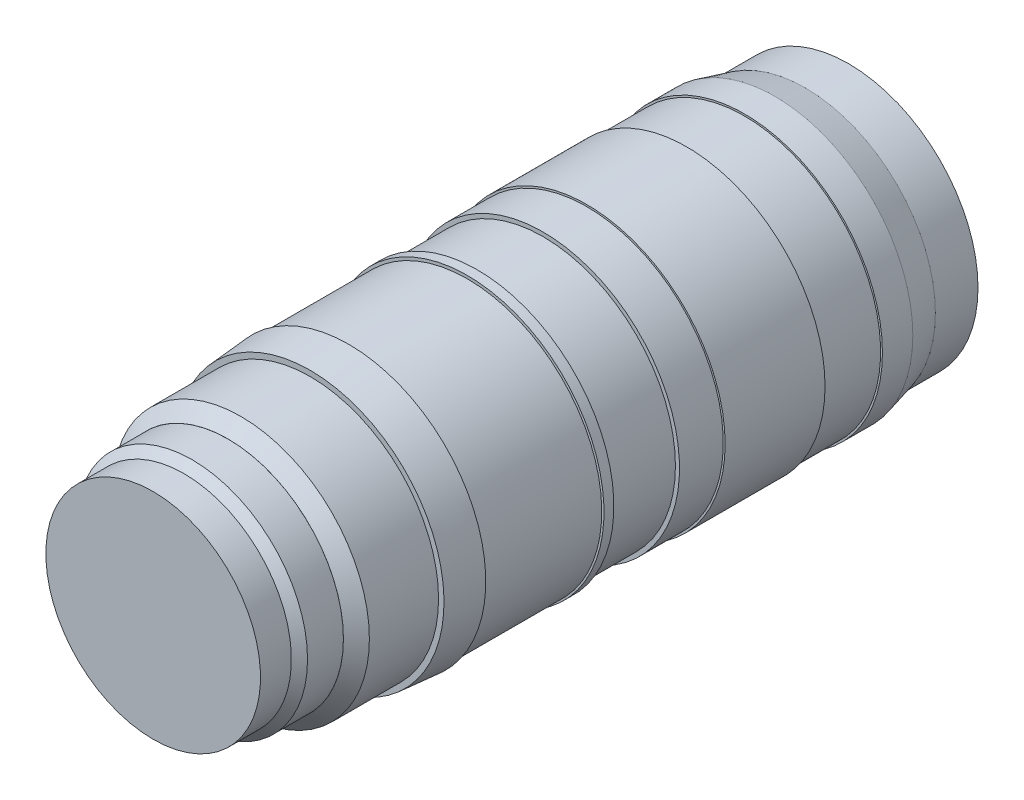
from build123d import *

# Parameters (mm, degrees)
CHAMFER1_SIZE       = 3.937
CHAMFER2_SIZE       = 2.54
SKETCH3_R           = 39.292876354
BOSS_EXTRUDE1_DEPTH = 13.15
SKETCH4_R           = 37.648699114
CUT_EXTRUDE1_DEPTH  = 2


with BuildPart() as part:
    # Sketch1 → Revolve1 (revolve)
    with BuildSketch(Plane(origin=(0, 0, 0), x_dir=(0, 0, -1), z_dir=(1, 0, 0))):
        Polygon((-107.78, -0.223974787), (-203.2, -0.223974787), (-203.2, 32.371025213), (-193.9, 32.371025213), (-193.9, 34.821025213), (-180.47, 34.821025213), (-180.47, 38.776025213), (-155.52, 38.776025213), (-155.52, 40.426025213), (-143.78, 41.376025213), (-143.78, 40.601025213), (-107.78, 40.601025213), align=None)
    revolve(axis=Axis((0, -0.223974787, 107.78), (0, 0, 1)))

    # Chamfer1
    chamfer1_edges = [part.edges().sort_by_distance(p)[0] for p in [
        (0, -39.223974787, 180.47),
    ]]
    chamfer(chamfer1_edges, length=CHAMFER1_SIZE)

    # Chamfer2
    # the kernel refuses this chamfer: 2.54 mm, written as the material it takes off along each edge
    with BuildSketch(Plane(origin=(0, -0.223974787, 193.9), x_dir=(0, 1, 0), z_dir=(1, 0, 0))) as chamfer2_piece_1_section:
        Polygon((35.045, -CHAMFER2_SIZE), (35.045 - CHAMFER2_SIZE, 0), (35.045, 0), align=None)
    chamfer2_piece_1 = revolve(axis=Axis((0, -0.223974787, 193.9), (0, 0, 1)), mode=Mode.PRIVATE)
    chamfer2_piece_1 = chamfer2_piece_1 - Plane(origin=(0, -0.223974787, 192.613574864), x_dir=(0, 1, 0), z_dir=(0, 0, -1)) * Cylinder(32.595, 141, mode=Mode.PRIVATE)
    add(chamfer2_piece_1, mode=Mode.SUBTRACT)

    # Sketch2 → Revolve2 (revolve)
    with BuildSketch(Plane(origin=(0, 0, 0), x_dir=(1, 0, 0), z_dir=(0, 1, 0))):
        Polygon((-40.825, -107.78), (-41.5, -107.78), (-41.5, -104.78), (-40.2, -104.78), (-40.2, -84.78), (-41.43, -84.78), (-41.43, -71.48), (-42, -71.48), (-42, -41.14), (-41.35, -41.14), (-41.35, -23.61), (-41.905, -23.61), (-41.905, -14.39), (-39.5, -5.13), (0, -5.13), (0, -107.78), align=None)
    revolve(axis=Axis((0, 0, 5.13), (0, 0, 1)))

    # Sketch3 → Boss-Extrude1 (add)
    with BuildSketch(Plane(origin=(0, 0, 5.13), x_dir=(-1, 0, 0), z_dir=(0, 0, -1))):
        Circle(SKETCH3_R)
    extrude(amount=BOSS_EXTRUDE1_DEPTH)

    # Sketch4 → Cut-Extrude1 (cut)
    with BuildSketch(Plane(origin=(0, 0, -8.02), x_dir=(-1, 0, 0), z_dir=(0, 0, -1))):
        Circle(SKETCH4_R)
    extrude(amount=-CUT_EXTRUDE1_DEPTH, mode=Mode.SUBTRACT)


solid = part.part
